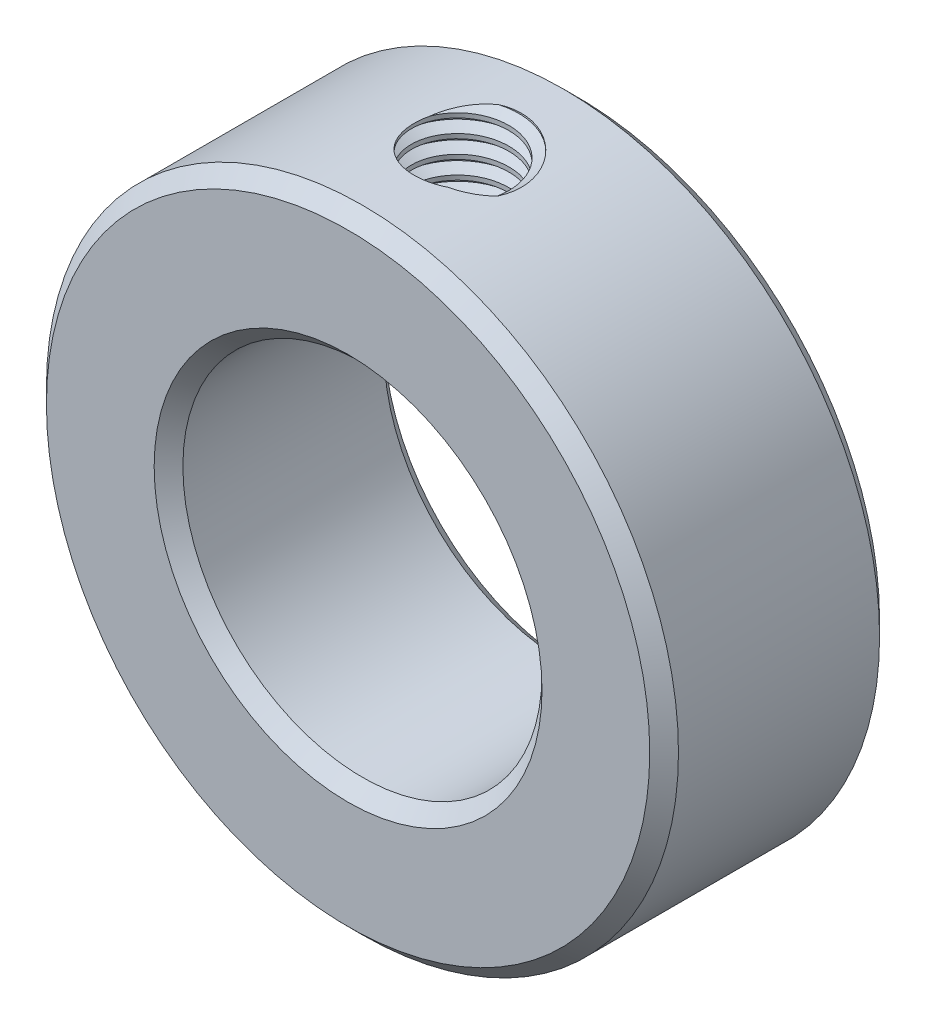
from build123d import *

# Parameters (mm, degrees)
SKETCH2_R               = 22
SKETCH2_R_2             = 12.5
BOSS_EXTRUDE1_DEPTH     = 16
CUT_EXTRUDE1_REACH      = 53.73
CUT_EXTRUDE1_END_RADIUS = 12.5
SKETCH3_R               = 3.4
CHAMFER1_SIZE           = 1
THREAD1_PITCH           = 1.25


with BuildPart() as part:
    # Sketch2 → Boss-Extrude1 (new body)
    with BuildSketch(Plane.XY):
        Circle(SKETCH2_R)
        Circle(SKETCH2_R_2, mode=Mode.SUBTRACT)
    extrude(amount=BOSS_EXTRUDE1_DEPTH)

    # Cut-Extrude1: up to this cylinder (the profile starts outside it)
    cut_extrude1_end = Plane(origin=(0, 0, 8), z_dir=(0, 0, -1)) * Cylinder(CUT_EXTRUDE1_END_RADIUS, 133.46, mode=Mode.PRIVATE)
    # Sketch3 → Cut-Extrude1 (cut, up to the surface)
    with BuildSketch(Plane(origin=(0, 22, 0), x_dir=(1, 0, 0), z_dir=(0, 1, 0)), mode=Mode.PRIVATE) as cut_extrude1_sk1:
        with Locations(Location((0, -8, 0), (0, 0, 270))):
            Circle(SKETCH3_R)
    cut_extrude1_tool1 = extrude(cut_extrude1_sk1.sketch, amount=-CUT_EXTRUDE1_REACH, mode=Mode.PRIVATE) - cut_extrude1_end
    add(cut_extrude1_tool1.solids().sort_by_distance((0, 22, 8))[0], mode=Mode.SUBTRACT)

    # Chamfer1
    chamfer1_edges = [part.edges().sort_by_distance(p)[0] for p in [
        (-22, 0, 0),
        (-22, 0, 16),
        (-12.5, 0, 0),
        (-12.5, 0, 16),
    ]]
    chamfer(chamfer1_edges, length=CHAMFER1_SIZE)

    # Thread1: the profile of Thread Profile1 profile screwed along a right-hand helix of 12 turns, 8 arcs to a turn; built about Z, then put on its axis
    thread1_z = Axis((0, 0, 0), (0, 0, 1))
    thread1_corners = [(3.3997, 0, -0.000173205), (4.076582344, 0, 0.390624998), (4.076582344, 0, 0.546874998), (3.3997, 0, 0.937673202)]
    with BuildLine(mode=Mode.PRIVATE) as thread1_profile:
        Line(thread1_corners[0], thread1_corners[1])
        Line(thread1_corners[1], thread1_corners[2])
        Line(thread1_corners[2], thread1_corners[3])
        Line(thread1_corners[3], thread1_corners[0])
    thread1_cap = Face(thread1_profile.wire())
    thread1_turn_angles = [0, 22.5, 45, 67.5, 90, 112.5, 135, 157.5, 180, 202.5, 225, 247.5, 270, 292.5, 315, 337.5, 360]
    thread1_turn_weights = [1, 0.9238795325112867, 1, 0.9238795325112867, 1, 0.9238795325112867, 1, 0.9238795325112867, 1, 0.9238795325112867, 1, 0.9238795325112867, 1, 0.9238795325112867, 1, 0.9238795325112867, 1]
    thread1_turn_rails = [Edge.make_bspline([Vector(p[0], p[1], 0).rotate(thread1_z, thread1_turn_angles[k]) / thread1_turn_weights[k] + Vector(0, 0, p[2] + THREAD1_PITCH * thread1_turn_angles[k] / 360) for k in range(17)], [0, 0, 0, 1, 1, 2, 2, 3, 3, 4, 4, 5, 5, 6, 6, 7, 7, 8, 8, 8], 2, thread1_turn_weights) for p in thread1_corners]
    thread1_turn_sides = [Face.make_surface_from_curves(thread1_turn_rails[p[0]], thread1_turn_rails[p[1]]) for p in [(0, 1), (1, 2), (2, 3), (3, 0)]]
    thread1 = Plane(origin=(0, 24, 8), x_dir=(-1, 0, 0), z_dir=(0, -1, 0)) * Solid(Shell([*[p.moved(Location((0, 0, THREAD1_PITCH * i))) for i in range(12) for p in thread1_turn_sides], thread1_cap, thread1_cap.rotate(thread1_z, 4320).moved(Location((0, 0, THREAD1_PITCH * 4320 / 360)))]))
    add(thread1, mode=Mode.SUBTRACT)


solid = part.part
